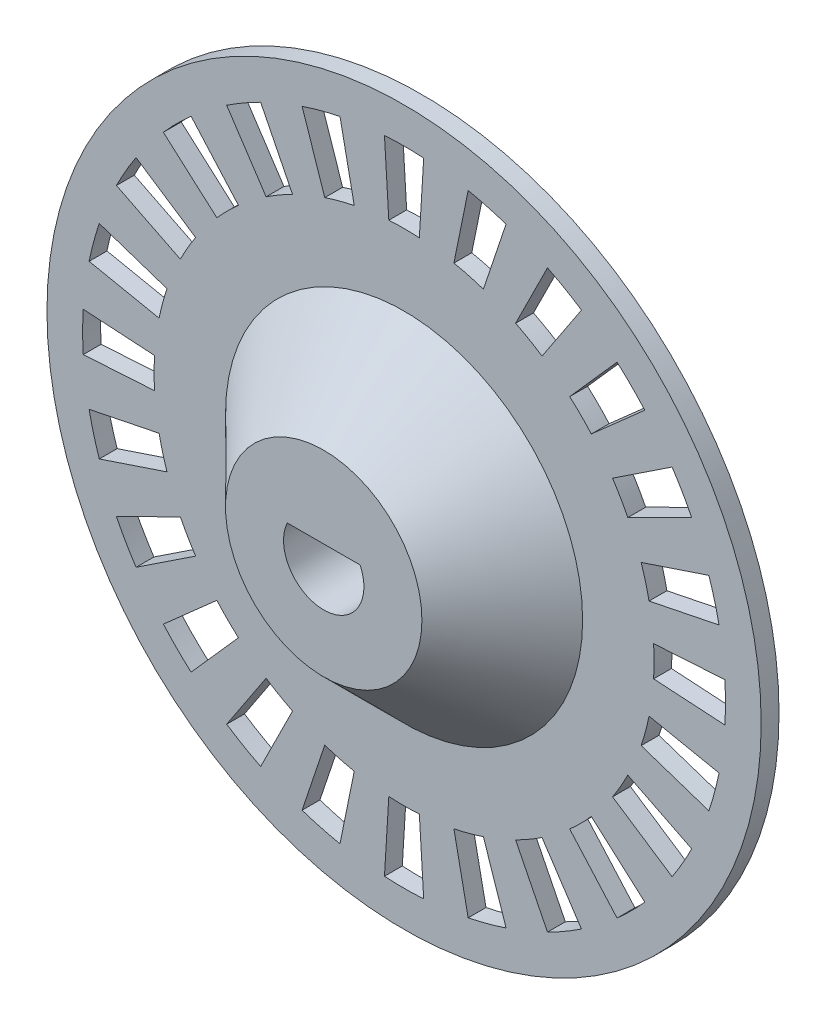
from build123d import *

# Parameters (mm, degrees)
CROQUIS2_R              = 20
SALIENTE_EXTRUIR2_DEPTH = 1
CROQUIS2_5_R            = 5
SALIENTE_EXTRUIR3_DEPTH = 5.5
CHAFL_N1_SIZE           = 5
CORTAR_EXTRUIR1_DEPTH   = 29.814059068


with BuildPart() as part:
    # Croquis2 → Saliente-Extruir2 (new body)
    with BuildSketch(Plane.XY):
        Circle(CROQUIS2_R)
        with BuildLine():
            Line((-2.039607805, 0.95), (2.039607805, 0.95))
            ThreePointArc((2.039607805, 0.95), (0, -2.25), (-2.039607805, 0.95))
        make_face(mode=Mode.SUBTRACT)
        with BuildLine():
            Line((-0.854679553, 13.973887178), (-1.098873712, 17.966426372))
            ThreePointArc((-1.098873712, 17.966426372), (0, 18), (1.098873712, 17.966426372))
            Line((1.098873712, 17.966426372), (0.854679553, 13.973887178))
            ThreePointArc((0.854679553, 13.973887178), (0, 14), (-0.854679553, 13.973887178))
        make_face(mode=Mode.SUBTRACT)
        with BuildLine():
            Line((-3.58862282, 17.638644683), (-2.791151082, 13.718945865))
            ThreePointArc((-2.791151082, 13.718945865), (-3.623466631, 13.522961568), (-4.44226519, 13.276531173))
            Line((-4.44226519, 13.276531173), (-5.711483815, 17.069825794))
            ThreePointArc((-5.711483815, 17.069825794), (-4.658742812, 17.386664873), (-3.58862282, 17.638644683))
        make_face(mode=Mode.SUBTRACT)
        with BuildLine():
            Line((-8.031560636, 16.108818509), (-6.246769384, 12.529081062))
            ThreePointArc((-6.246769384, 12.529081062), (-7, 12.124355653), (-7.727117794, 11.674401509))
            Line((-7.727117794, 11.674401509), (-9.934865736, 15.009944797))
            ThreePointArc((-9.934865736, 15.009944797), (-9, 15.588457268), (-8.031560636, 16.108818509))
        make_face(mode=Mode.SUBTRACT)
        with BuildLine():
            Line((-11.927160868, 13.481202974), (-9.276680675, 10.485380091))
            ThreePointArc((-9.276680675, 10.485380091), (-9.899494937, 9.899494937), (-10.485380091, 9.276680675))
            Line((-10.485380091, 9.276680675), (-13.481202974, 11.927160868))
            ThreePointArc((-13.481202974, 11.927160868), (-12.727922061, 12.727922061), (-11.927160868, 13.481202974))
        make_face(mode=Mode.SUBTRACT)
        with BuildLine():
            Line((-15.009944797, 9.934865736), (-11.674401509, 7.727117794))
            ThreePointArc((-11.674401509, 7.727117794), (-12.124355653, 7), (-12.529081062, 6.246769384))
            Line((-12.529081062, 6.246769384), (-16.108818509, 8.031560636))
            ThreePointArc((-16.108818509, 8.031560636), (-15.588457268, 9), (-15.009944797, 9.934865736))
        make_face(mode=Mode.SUBTRACT)
        with BuildLine():
            Line((-17.069825794, 5.711483815), (-13.276531173, 4.44226519))
            ThreePointArc((-13.276531173, 4.44226519), (-13.522961568, 3.623466631), (-13.718945865, 2.791151082))
            Line((-13.718945865, 2.791151082), (-17.638644683, 3.58862282))
            ThreePointArc((-17.638644683, 3.58862282), (-17.386664873, 4.658742812), (-17.069825794, 5.711483815))
        make_face(mode=Mode.SUBTRACT)
        with BuildLine():
            Line((-17.966426372, 1.098873712), (-13.973887178, 0.854679553))
            ThreePointArc((-13.973887178, 0.854679553), (-14, 0), (-13.973887178, -0.854679553))
            Line((-13.973887178, -0.854679553), (-17.966426372, -1.098873712))
            ThreePointArc((-17.966426372, -1.098873712), (-18, 0), (-17.966426372, 1.098873712))
        make_face(mode=Mode.SUBTRACT)
        with BuildLine():
            Line((-17.638644683, -3.58862282), (-13.718945865, -2.791151082))
            ThreePointArc((-13.718945865, -2.791151082), (-13.522961568, -3.623466631), (-13.276531173, -4.44226519))
            Line((-13.276531173, -4.44226519), (-17.069825794, -5.711483815))
            ThreePointArc((-17.069825794, -5.711483815), (-17.386664873, -4.658742812), (-17.638644683, -3.58862282))
        make_face(mode=Mode.SUBTRACT)
        with BuildLine():
            Line((-16.108818509, -8.031560636), (-12.529081062, -6.246769384))
            ThreePointArc((-12.529081062, -6.246769384), (-12.124355653, -7), (-11.674401509, -7.727117794))
            Line((-11.674401509, -7.727117794), (-15.009944797, -9.934865736))
            ThreePointArc((-15.009944797, -9.934865736), (-15.588457268, -9), (-16.108818509, -8.031560636))
        make_face(mode=Mode.SUBTRACT)
        with BuildLine():
            Line((-13.481202974, -11.927160868), (-10.485380091, -9.276680675))
            ThreePointArc((-10.485380091, -9.276680675), (-9.899494937, -9.899494937), (-9.276680675, -10.485380091))
            Line((-9.276680675, -10.485380091), (-11.927160868, -13.481202974))
            ThreePointArc((-11.927160868, -13.481202974), (-12.727922061, -12.727922061), (-13.481202974, -11.927160868))
        make_face(mode=Mode.SUBTRACT)
        with BuildLine():
            Line((-9.934865736, -15.009944797), (-7.727117794, -11.674401509))
            ThreePointArc((-7.727117794, -11.674401509), (-7, -12.124355653), (-6.246769384, -12.529081062))
            Line((-6.246769384, -12.529081062), (-8.031560636, -16.108818509))
            ThreePointArc((-8.031560636, -16.108818509), (-9, -15.588457268), (-9.934865736, -15.009944797))
        make_face(mode=Mode.SUBTRACT)
        with BuildLine():
            Line((-5.711483815, -17.069825794), (-4.44226519, -13.276531173))
            ThreePointArc((-4.44226519, -13.276531173), (-3.623466631, -13.522961568), (-2.791151082, -13.718945865))
            Line((-2.791151082, -13.718945865), (-3.58862282, -17.638644683))
            ThreePointArc((-3.58862282, -17.638644683), (-4.658742812, -17.386664873), (-5.711483815, -17.069825794))
        make_face(mode=Mode.SUBTRACT)
        with BuildLine():
            Line((-1.098873712, -17.966426372), (-0.854679553, -13.973887178))
            ThreePointArc((-0.854679553, -13.973887178), (0, -14), (0.854679553, -13.973887178))
            Line((0.854679553, -13.973887178), (1.098873712, -17.966426372))
            ThreePointArc((1.098873712, -17.966426372), (0, -18), (-1.098873712, -17.966426372))
        make_face(mode=Mode.SUBTRACT)
        with BuildLine():
            Line((3.58862282, -17.638644683), (2.791151082, -13.718945865))
            ThreePointArc((2.791151082, -13.718945865), (3.623466631, -13.522961568), (4.44226519, -13.276531173))
            Line((4.44226519, -13.276531173), (5.711483815, -17.069825794))
            ThreePointArc((5.711483815, -17.069825794), (4.658742812, -17.386664873), (3.58862282, -17.638644683))
        make_face(mode=Mode.SUBTRACT)
        with BuildLine():
            Line((8.031560636, -16.108818509), (6.246769384, -12.529081062))
            ThreePointArc((6.246769384, -12.529081062), (7, -12.124355653), (7.727117794, -11.674401509))
            Line((7.727117794, -11.674401509), (9.934865736, -15.009944797))
            ThreePointArc((9.934865736, -15.009944797), (9, -15.588457268), (8.031560636, -16.108818509))
        make_face(mode=Mode.SUBTRACT)
        with BuildLine():
            Line((11.927160868, -13.481202974), (9.276680675, -10.485380091))
            ThreePointArc((9.276680675, -10.485380091), (9.899494937, -9.899494937), (10.485380091, -9.276680675))
            Line((10.485380091, -9.276680675), (13.481202974, -11.927160868))
            ThreePointArc((13.481202974, -11.927160868), (12.727922061, -12.727922061), (11.927160868, -13.481202974))
        make_face(mode=Mode.SUBTRACT)
        with BuildLine():
            Line((15.009944797, -9.934865736), (11.674401509, -7.727117794))
            ThreePointArc((11.674401509, -7.727117794), (12.124355653, -7), (12.529081062, -6.246769384))
            Line((12.529081062, -6.246769384), (16.108818509, -8.031560636))
            ThreePointArc((16.108818509, -8.031560636), (15.588457268, -9), (15.009944797, -9.934865736))
        make_face(mode=Mode.SUBTRACT)
        with BuildLine():
            Line((17.069825794, -5.711483815), (13.276531173, -4.44226519))
            ThreePointArc((13.276531173, -4.44226519), (13.522961568, -3.623466631), (13.718945865, -2.791151082))
            Line((13.718945865, -2.791151082), (17.638644683, -3.58862282))
            ThreePointArc((17.638644683, -3.58862282), (17.386664873, -4.658742812), (17.069825794, -5.711483815))
        make_face(mode=Mode.SUBTRACT)
        with BuildLine():
            Line((17.966426372, -1.098873712), (13.973887178, -0.854679553))
            ThreePointArc((13.973887178, -0.854679553), (14, 0), (13.973887178, 0.854679553))
            Line((13.973887178, 0.854679553), (17.966426372, 1.098873712))
            ThreePointArc((17.966426372, 1.098873712), (18, 0), (17.966426372, -1.098873712))
        make_face(mode=Mode.SUBTRACT)
        with BuildLine():
            Line((17.638644683, 3.58862282), (13.718945865, 2.791151082))
            ThreePointArc((13.718945865, 2.791151082), (13.522961568, 3.623466631), (13.276531173, 4.44226519))
            Line((13.276531173, 4.44226519), (17.069825794, 5.711483815))
            ThreePointArc((17.069825794, 5.711483815), (17.386664873, 4.658742812), (17.638644683, 3.58862282))
        make_face(mode=Mode.SUBTRACT)
        with BuildLine():
            Line((16.108818509, 8.031560636), (12.529081062, 6.246769384))
            ThreePointArc((12.529081062, 6.246769384), (12.124355653, 7), (11.674401509, 7.727117794))
            Line((11.674401509, 7.727117794), (15.009944797, 9.934865736))
            ThreePointArc((15.009944797, 9.934865736), (15.588457268, 9), (16.108818509, 8.031560636))
        make_face(mode=Mode.SUBTRACT)
        with BuildLine():
            Line((13.481202974, 11.927160868), (10.485380091, 9.276680675))
            ThreePointArc((10.485380091, 9.276680675), (9.899494937, 9.899494937), (9.276680675, 10.485380091))
            Line((9.276680675, 10.485380091), (11.927160868, 13.481202974))
            ThreePointArc((11.927160868, 13.481202974), (12.727922061, 12.727922061), (13.481202974, 11.927160868))
        make_face(mode=Mode.SUBTRACT)
        with BuildLine():
            Line((9.934865736, 15.009944797), (7.727117794, 11.674401509))
            ThreePointArc((7.727117794, 11.674401509), (7, 12.124355653), (6.246769384, 12.529081062))
            Line((6.246769384, 12.529081062), (8.031560636, 16.108818509))
            ThreePointArc((8.031560636, 16.108818509), (9, 15.588457268), (9.934865736, 15.009944797))
        make_face(mode=Mode.SUBTRACT)
        with BuildLine():
            Line((5.711483815, 17.069825794), (4.44226519, 13.276531173))
            ThreePointArc((4.44226519, 13.276531173), (3.623466631, 13.522961568), (2.791151082, 13.718945865))
            Line((2.791151082, 13.718945865), (3.58862282, 17.638644683))
            ThreePointArc((3.58862282, 17.638644683), (4.658742812, 17.386664873), (5.711483815, 17.069825794))
        make_face(mode=Mode.SUBTRACT)
    extrude(amount=SALIENTE_EXTRUIR2_DEPTH)

    # Croquis2<5> → Saliente-Extruir3 (add)
    with BuildSketch(Plane.XY):
        Circle(CROQUIS2_5_R)
    extrude(amount=SALIENTE_EXTRUIR3_DEPTH)

    # Chaflán1
    # the kernel refuses this chamfer: 5 mm, written as the material it adds along each edge
    with BuildSketch(Plane(origin=(0, 0, 1), x_dir=(1, 0, 0), z_dir=(0, 1, 0))) as chafl_n1_piece_1_section:
        Polygon((5 + CHAFL_N1_SIZE, 0), (5, -CHAFL_N1_SIZE), (5, 0), align=None)
    chafl_n1_piece_1 = revolve(axis=Axis((0, 0, 1), (0, 0, -1)), mode=Mode.PRIVATE)
    chafl_n1_piece_1 = split(chafl_n1_piece_1, bisect_by=Plane(origin=(-7.762197096, 0, 5.5), z_dir=(0, 0, -1)), keep=Keep.TOP, mode=Mode.PRIVATE)
    add(chafl_n1_piece_1)

    # Croquis2<6> → Cortar-Extruir1 (cut, through all)
    with BuildSketch(Plane.XY):
        with BuildLine():
            Line((2.039607805, 0.95), (-2.039607805, 0.95))
            ThreePointArc((-2.039607805, 0.95), (-0.486509218, -2.196772355), (2.25, 0))
            ThreePointArc((2.25, 0), (2.196772355, 0.486509218), (2.039607805, 0.95))
        make_face()
    extrude(amount=CORTAR_EXTRUIR1_DEPTH, mode=Mode.SUBTRACT)


solid = part.part
